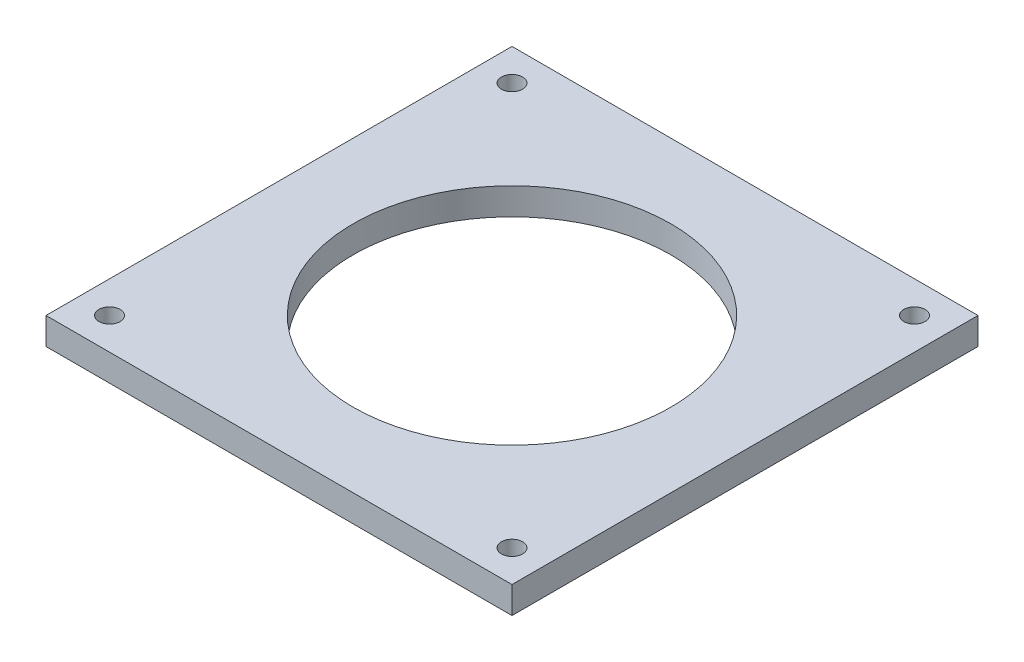
from build123d import *

# Parameters (mm, degrees)
SKETCH1_R           = 1
BOSS_EXTRUDE1_DEPTH = 2.54
MIRROR2_OUTLINE_R   = 1
MIRROR2_DEPTH       = 2.54


# Read off the part's stored shape, not the designer's step: Mirror2
with BuildPart() as part:
    # Sketch1 → Boss-Extrude1 (new body)
    with BuildSketch(Plane(origin=(0, 0, 0), x_dir=(1, 0, 0), z_dir=(0, 1, 0))):
        with BuildLine():
            Line((0, 22), (0, 15))
            ThreePointArc((0, 15), (-10.606601718, 10.606601718), (-15, 0))
            Line((-15, 0), (-22, 0))
            Line((-22, 0), (-22, 22))
            Line((-22, 22), (0, 22))
        make_face()
        with Locations(Location((-19, 19, 0), (0, 0, 270))):
            Circle(SKETCH1_R, mode=Mode.SUBTRACT)
    extrude(amount=BOSS_EXTRUDE1_DEPTH)

    # Mirror2 outline → Mirror2 (add)
    with BuildSketch(Plane(origin=(0, 0, 0), x_dir=(1, 0, 0), z_dir=(0, 1, 0))):
        with BuildLine():
            Line((22, 22), (0, 22))
            Line((0, 22), (0, 15))
            ThreePointArc((0, 15), (10.606601718, -10.606601718), (-15, 0))
            Line((-15, 0), (-22, 0))
            Line((-22, 0), (-22, -22))
            Line((-22, -22), (22, -22))
            Line((22, -22), (22, 22))
        make_face()
        with Locations((-19, -19)):
            Circle(MIRROR2_OUTLINE_R, mode=Mode.SUBTRACT)
        with Locations((19, -19)):
            Circle(MIRROR2_OUTLINE_R, mode=Mode.SUBTRACT)
        with Locations((19, 19)):
            Circle(MIRROR2_OUTLINE_R, mode=Mode.SUBTRACT)
    extrude(amount=MIRROR2_DEPTH)


solid = part.part
